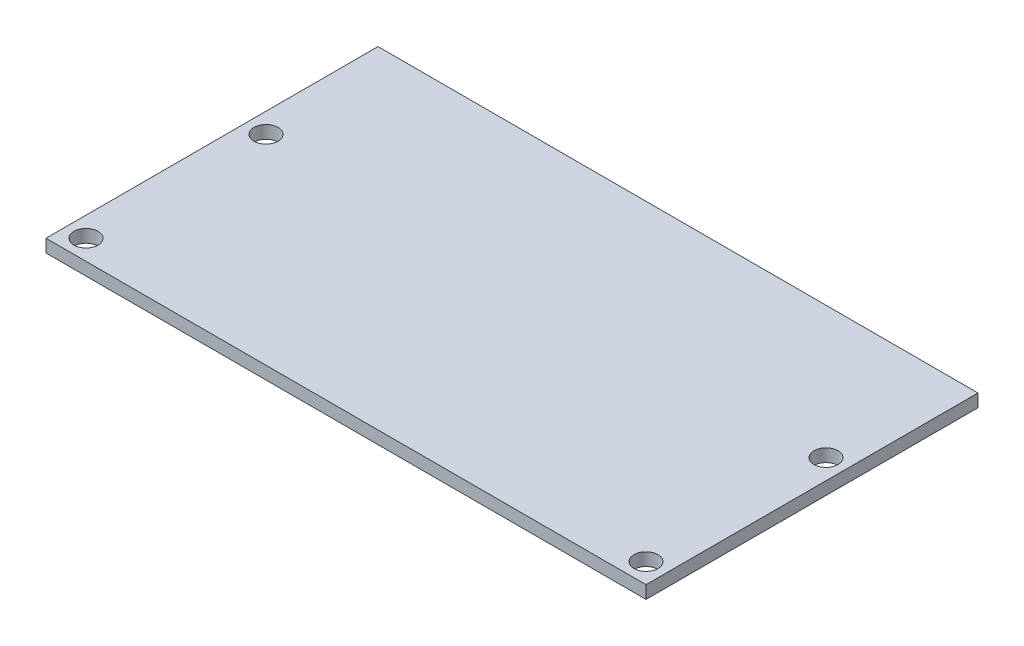
from build123d import *

# Parameters (mm, degrees)
SKETCH1_W           = 75
SKETCH1_H           = 41.5
BOSS_EXTRUDE1_DEPTH = 1.6
SKETCH2_R           = 1.5
CUT_EXTRUDE1_DEPTH  = 1.6


with BuildPart() as part:
    # Sketch1 → Boss-Extrude1 (new body)
    with BuildSketch(Plane(origin=(0, 0, 0), x_dir=(1, 0, 0), z_dir=(0, 1, 0))):
        with Locations((37.5, 20.75)):
            Rectangle(SKETCH1_W, SKETCH1_H)
    extrude(amount=BOSS_EXTRUDE1_DEPTH)

    # Sketch2 → Cut-Extrude1 (cut)
    with BuildSketch(Plane.XZ):
        with Locations((2.5, -2.5)):
            Circle(SKETCH2_R)
        with Locations((72.5, -2.5)):
            Circle(SKETCH2_R)
        with Locations((72.5, -25)):
            Circle(SKETCH2_R)
        with Locations((2.5, -25)):
            Circle(SKETCH2_R)
    extrude(amount=-CUT_EXTRUDE1_DEPTH, mode=Mode.SUBTRACT)


solid = part.part
